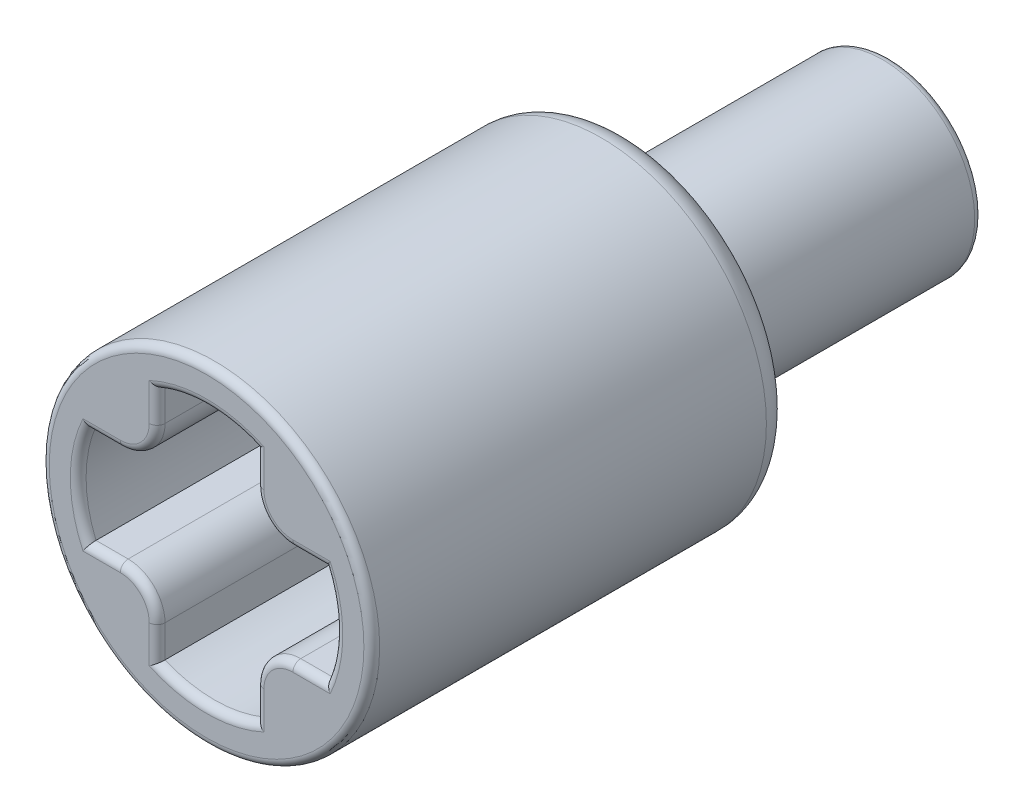
from build123d import *

# Parameters (mm, degrees)
SKETCH1_R           = 1.75
SKETCH1_R_2         = 1
BOSS_EXTRUDE1_DEPTH = 5
SKETCH2_R           = 3.14
BOSS_EXTRUDE2_DEPTH = 1
SKETCH2_4_R         = 3.14
BOSS_EXTRUDE3_DEPTH = 8
FILLET1_R           = 0.5
FILLET2_R           = 0.7
FILLET3_R           = 0.15
FILLET4_R           = 0.15


with BuildPart() as part:
    # Sketch1 → Boss-Extrude1 (new body)
    with BuildSketch(Plane.XY):
        Circle(SKETCH1_R)
        Circle(SKETCH1_R_2, mode=Mode.SUBTRACT)
    extrude(amount=BOSS_EXTRUDE1_DEPTH)

    # Sketch2 → Boss-Extrude2 (add)
    with BuildSketch(Plane.XY.offset(5)):
        Circle(SKETCH2_R)
    extrude(amount=BOSS_EXTRUDE2_DEPTH)

    # Sketch2<4> → Boss-Extrude3 (add)
    with BuildSketch(Plane.XY.offset(5)):
        Circle(SKETCH2_4_R)
        with BuildLine():
            Line((0.94, 0.94), (2.25166605, 0.94))
            ThreePointArc((2.25166605, 0.94), (2.44, 0), (2.25166605, -0.94))
            Line((2.25166605, -0.94), (0.94, -0.94))
            Line((0.94, -0.94), (0.94, -2.25166605))
            ThreePointArc((0.94, -2.25166605), (0, -2.44), (-0.94, -2.25166605))
            Line((-0.94, -2.25166605), (-0.94, -0.94))
            Line((-0.94, -0.94), (-2.25166605, -0.94))
            ThreePointArc((-2.25166605, -0.94), (-2.44, 0), (-2.25166605, 0.94))
            Line((-2.25166605, 0.94), (-0.94, 0.94))
            Line((-0.94, 0.94), (-0.94, 2.25166605))
            ThreePointArc((-0.94, 2.25166605), (0, 2.44), (0.94, 2.25166605))
            Line((0.94, 2.25166605), (0.94, 0.94))
        make_face(mode=Mode.SUBTRACT)
    extrude(amount=BOSS_EXTRUDE3_DEPTH)

    # Fillet1
    fillet1_edges = [part.edges().sort_by_distance(p)[0] for p in [
        (-3.14, 0, 5),
        (-1.75, 0, 5),
    ]]
    fillet(fillet1_edges, radius=FILLET1_R)

    # Fillet2
    fillet2_edges = [part.edges().sort_by_distance(p)[0] for p in [
        (-0.94, 0.94, 9.5),
        (0.94, 0.94, 9.5),
        (0.94, -0.94, 9.5),
        (-0.94, -0.94, 9.5),
    ]]
    fillet(fillet2_edges, radius=FILLET2_R)

    # Fillet3
    fillet3_edges = [part.edges().sort_by_distance(p)[0] for p in [
        (-1.75, 0, 0),
        (-1, 0, 0),
    ]]
    fillet(fillet3_edges, radius=FILLET3_R)

    # Fillet4
    fillet4_edges = [part.edges().sort_by_distance(p)[0] for p in [
        (-0.94, -1.945833025, 13),
        (-1.145025253, -1.145025253, 13),
        (-1.945833025, 0.94, 13),
        (-1.145025253, 1.145025253, 13),
        (0.94, -1.945833025, 13),
        (1.145025253, -1.145025253, 13),
        (1.945833025, 0.94, 13),
        (1.145025253, 1.145025253, 13),
        (0, -2.44, 13),
        (-1.945833025, -0.94, 13),
        (-2.44, 0, 13),
        (-0.94, 1.945833025, 13),
        (0, 2.44, 13),
        (2.44, 0, 13),
        (1.945833025, -0.94, 13),
        (0.94, 1.945833025, 13),
        (-3.14, 0, 13),
    ]]
    fillet(fillet4_edges, radius=FILLET4_R)


solid = part.part
